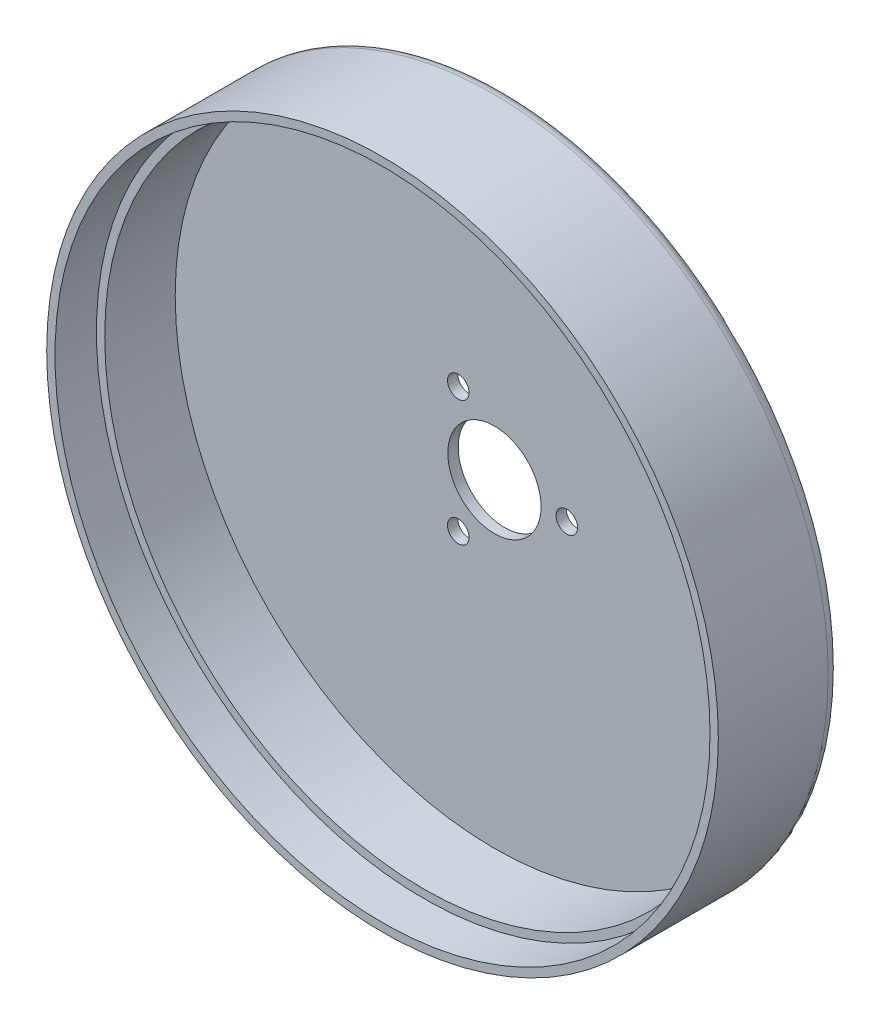
from build123d import *

# Parameters (mm, degrees)
SKETCH1_R           = 81
BOSS_EXTRUDE1_DEPTH = 2.5
SKETCH2_R           = 11.25
CUT_EXTRUDE1_DEPTH  = 115.578575659
SKETCH3_R           = 2.6
CUT_EXTRUDE2_DEPTH  = 115.578575659
SKETCH4_R           = 81
SKETCH4_R_2         = 77
BOSS_EXTRUDE2_DEPTH = 27
SKETCH5_R           = 79
CUT_EXTRUDE3_DEPTH  = 10
FILLET1_R           = 3


with BuildPart() as part:
    # Sketch1 → Boss-Extrude1 (new body)
    with BuildSketch(Plane.XY):
        Circle(SKETCH1_R)
    extrude(amount=BOSS_EXTRUDE1_DEPTH)

    # Sketch2 → Cut-Extrude1 (cut, through all)
    with BuildSketch(Plane.XY.offset(2.5)):
        Circle(SKETCH2_R)
    extrude(amount=-CUT_EXTRUDE1_DEPTH, mode=Mode.SUBTRACT)

    # Sketch3 → Cut-Extrude2 (cut, through all)
    with BuildSketch(Plane.XY.offset(2.5)):
        with Locations((17.45, 0)):
            Circle(SKETCH3_R)
        with Locations((-8.725, 15.112143296)):
            Circle(SKETCH3_R)
        with Locations((-8.725, -15.112143296)):
            Circle(SKETCH3_R)
    extrude(amount=-CUT_EXTRUDE2_DEPTH, mode=Mode.SUBTRACT)

    # Sketch4 → Boss-Extrude2 (add)
    with BuildSketch(Plane.XY.offset(2.5)):
        Circle(SKETCH4_R)
        Circle(SKETCH4_R_2, mode=Mode.SUBTRACT)
    extrude(amount=BOSS_EXTRUDE2_DEPTH)

    # Sketch5 → Cut-Extrude3 (cut)
    with BuildSketch(Plane.XY.offset(29.5)):
        Circle(SKETCH5_R)
    extrude(amount=-CUT_EXTRUDE3_DEPTH, mode=Mode.SUBTRACT)

    # Fillet1
    fillet1_edges = [part.edges().sort_by_distance(p)[0] for p in [
        (-81, 0, 0),
    ]]
    fillet(fillet1_edges, radius=FILLET1_R)


solid = part.part
